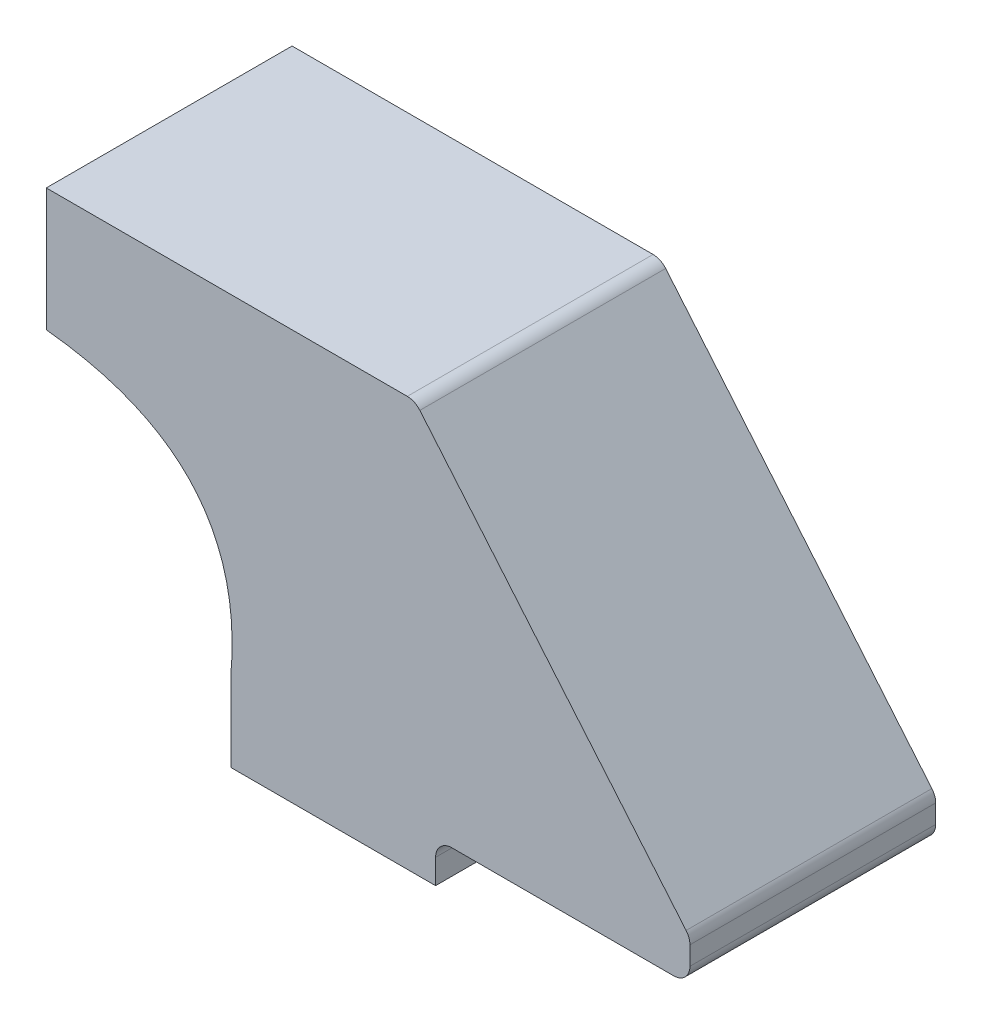
from build123d import *

# Parameters (mm, degrees)
BOSS_EXTRUDE1_DEPTH             = 38.1
SHELL1_START                    = 2.54
SHELL1_DEPTH                    = 33.02
SKETCH2_R                       = 9.525
SKETCH2_R_2                     = 6.35
BOSS_EXTRUDE2_DEPTH             = 35.56
BOSS_EXTRUDE2_DIRECTION_2_REACH = 98.336


# Read off the part's stored shape, not the designer's step: Shell1
with BuildPart() as part:
    # Sketch1 → Boss-Extrude1 (new body)
    with BuildSketch(Plane.XY):
        with BuildLine():
            Line((-28.597743471, 0), (27.367835077, 0))
            ThreePointArc((27.367835077, 0), (28.441285462, -0.237978221), (29.313587963, -0.907319471))
            Line((29.313587963, -0.907319471), (70.584270678, -50.091803866))
            ThreePointArc((70.584270678, -50.091803866), (71.025337049, -50.855753231), (71.178517793, -51.724484395))
            Line((71.178517793, -51.724484395), (71.178517793, -54.61))
            ThreePointArc((71.178517793, -54.61), (70.434569017, -56.406051224), (68.638517793, -57.15))
            Line((68.638517793, -57.15), (34.29, -57.15))
            ThreePointArc((34.29, -57.15), (32.493948776, -57.893948776), (31.75, -59.69))
            Line((31.75, -59.69), (31.75, -63.5))
            Line((31.75, -63.5), (0, -63.5))
            Line((0, -63.5), (0, -51.225562477))
            add(Edge.make_bspline(
                [(-28.597743471, -19.05), (2.699862554, -22.282217033), (0, -51.225562477)],
                knots=[0, 0, 0, 1, 1, 1], degree=2))
            Line((-28.597743471, -19.05), (-28.597743471, 0))
        make_face()
    extrude(amount=BOSS_EXTRUDE1_DEPTH)

    # Shell1 outline → Shell1 (cut)
    with BuildSketch(Plane.XY.offset(SHELL1_START)):
        with BuildLine():
            Line((-26.057743471, -2.54), (-26.057743471, -19.362677405))
            add(Edge.make_bspline(
                [(-26.057743471, -19.362677405), (2.587779826, -23.483777864), (0, -51.225562477)],
                knots=[0.041514235, 0.041514235, 0.041514235, 1, 1, 1], degree=2))
            Line((0, -51.225562477), (0, -60.96))
            Line((0, -60.96), (29.21, -60.96))
            Line((29.21, -60.96), (29.21, -59.69))
            ThreePointArc((29.21, -59.69), (30.697897552, -56.097897552), (34.29, -54.61))
            Line((34.29, -54.61), (68.638517793, -54.61))
            Line((68.638517793, -54.61), (68.638517793, -51.724484395))
            Line((68.638517793, -51.724484395), (27.367835077, -2.54))
            Line((27.367835077, -2.54), (-26.057743471, -2.54))
        make_face()
    extrude(amount=SHELL1_DEPTH, mode=Mode.SUBTRACT)

    # Sketch2 → Boss-Extrude2 (add)
    with BuildSketch(Plane.ZY.offset(-33.02)):
        with Locations((19.05, -31.75)):
            Circle(SKETCH2_R)
        with Locations((19.05, -31.75)):
            Circle(SKETCH2_R_2, mode=Mode.SUBTRACT)
    extrude(amount=BOSS_EXTRUDE2_DEPTH)

    # Boss-Extrude2 direction 2: up to this face of the body (flat: up to its plane)
    boss_extrude2_direction_2_end = Plane(part.part.faces().sort_by_distance((48.003176435, -27.132242197, 19.05))[0])
    # Sketch2 → Boss-Extrude2 direction 2 (add, up to the picked face)
    with BuildSketch(Plane.ZY.offset(-33.02), mode=Mode.PRIVATE) as boss_extrude2_direction_2_sk1:
        with Locations((19.05, -31.75)):
            Circle(SKETCH2_R)
        with Locations((19.05, -31.75)):
            Circle(SKETCH2_R_2, mode=Mode.SUBTRACT)
    boss_extrude2_direction_2_tool1 = split(extrude(boss_extrude2_direction_2_sk1.sketch, amount=-BOSS_EXTRUDE2_DIRECTION_2_REACH, mode=Mode.PRIVATE), bisect_by=boss_extrude2_direction_2_end, keep=Keep.BOTH, mode=Mode.PRIVATE)
    add(boss_extrude2_direction_2_tool1.solids().sort_by(Axis((33.02, -31.75, 9.794408), (1, 0, 0)))[0])


solid = part.part
